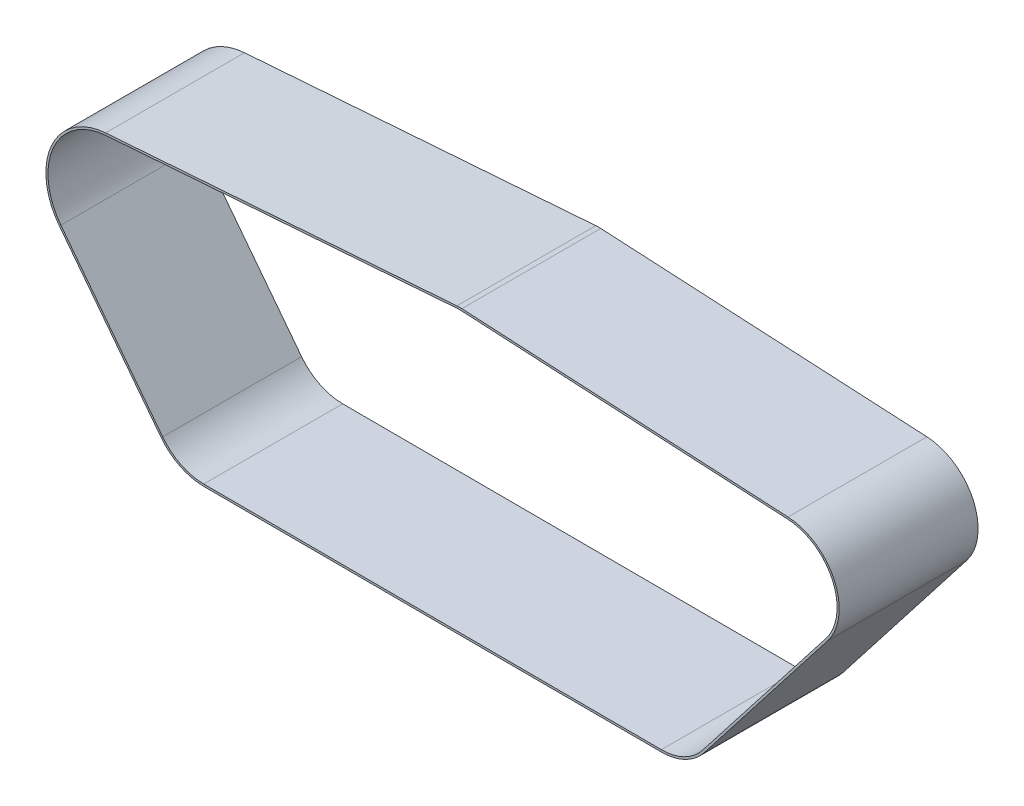
from build123d import *

# Parameters (mm, degrees)
EXTRUDE_THIN1_DEPTH = 23.5


with BuildPart() as part:
    # Sketch2 → Extrude-Thin1 (new, symmetric)
    with BuildSketch(Plane.XY):
        with BuildLine():
            Line((17.163468236, -58.085931667), (-17.281893756, -13.288195823))
            ThreePointArc((-17.281893756, -13.288195823), (-19.897637951, 8.906402414), (-1.60242719, 21.741026358))
            Line((-1.60242719, 21.741026358), (117.263507159, 30.502066523))
            ThreePointArc((117.263507159, 30.502066523), (118.105083127, 30.537349971), (118.94720479, 30.519290718))
            Line((118.94720479, 30.519290718), (229.299625502, 24.652631518))
            ThreePointArc((229.299625502, 24.652631518), (244.976573908, 13.975728829), (242.768549107, -4.862731534))
            Line((242.768549107, -4.862731534), (200.935093877, -58.602091631))
            ThreePointArc((200.935093877, -58.602091631), (194.508519277, -63.812915391), (186.443863356, -65.660852138))
            Line((186.443863356, -65.660852138), (31.619949002, -65.231091278))
            ThreePointArc((31.619949002, -65.231091278), (23.562249738, -63.336718399), (17.163468236, -58.085931667))
        make_face()
        with BuildLine():
            Line((17.71839143, -57.65924648), (-16.726970562, -12.861510636))
            ThreePointArc((-16.726970562, -12.861510636), (-19.258722971, 8.620417015), (-1.550973106, 21.042920007))
            Line((-1.550973106, 21.042920007), (117.314961243, 29.803960172))
            ThreePointArc((117.314961243, 29.803960172), (118.112243739, 29.837386596), (118.910043209, 29.820277831))
            Line((118.910043209, 29.820277831), (229.262463921, 23.95361863))
            ThreePointArc((229.262463921, 23.95361863), (244.339747634, 13.685122055), (242.216182798, -4.432741463))
            Line((242.216182798, -4.432741463), (200.382727568, -58.17210156))
            ThreePointArc((200.382727568, -58.17210156), (194.201978227, -63.183604192), (186.445806412, -64.960854834))
            Line((186.445806412, -64.960854834), (31.621892057, -64.531093975))
            ThreePointArc((31.621892057, -64.531093975), (23.872410798, -62.709183447), (17.71839143, -57.65924648))
        make_face(mode=Mode.SUBTRACT)
    extrude(amount=EXTRUDE_THIN1_DEPTH, both=True)


solid = part.part
